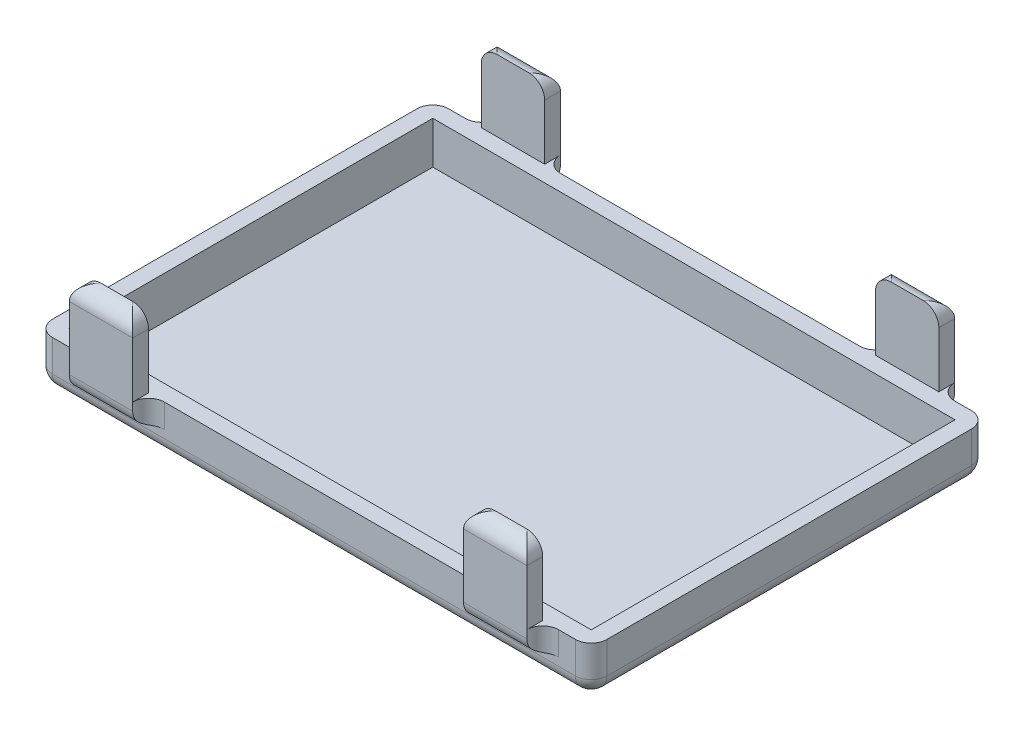
from build123d import *

# Parameters (mm, degrees)
SKETCH1_W            = 350
SKETCH1_H            = 250
SKETCH1_W_2          = 329.63
SKETCH1_H_2          = 229.64
BOSS_EXTRUDE2_DEPTH  = 30
SKETCH1_3_W          = 329.63
SKETCH1_3_H          = 229.64
BOSS_EXTRUDE3_DEPTH  = 3.3
FILLET1_R            = 10
SKETCH3_W            = 40
SKETCH3_H            = 60
BOSS_EXTRUDE4_DEPTH  = 10
FILLET3_R            = 10
FILLET4_R            = 10
FILLET3_OF_MIRROR3_R = 10
FILLET4_OF_MIRROR3_R = 10
FILLET5_START        = 25.0000001
FILLET5_DEPTH        = 4.9999999
FILLET5_START_2      = 14.9999999
FILLET5_2_DEPTH      = 10.0000002
FILLET5_START_3      = -155
FILLET5_3_DEPTH      = 310


with BuildPart() as part:
    # Sketch1 → Boss-Extrude2 (new body)
    with BuildSketch(Plane(origin=(0, 0, 0), x_dir=(1, 0, 0), z_dir=(0, 1, 0))):
        Rectangle(SKETCH1_W, SKETCH1_H)
        Rectangle(SKETCH1_W_2, SKETCH1_H_2, mode=Mode.SUBTRACT)
    extrude(amount=BOSS_EXTRUDE2_DEPTH)

    # Sketch1<3> → Boss-Extrude3 (add)
    with BuildSketch(Plane(origin=(0, 0, 0), x_dir=(1, 0, 0), z_dir=(0, 1, 0))):
        Rectangle(SKETCH1_3_W, SKETCH1_3_H)
    extrude(amount=BOSS_EXTRUDE3_DEPTH)

    # Fillet1
    fillet1_edges = [part.edges().sort_by_distance(p)[0] for p in [
        (0, 0, -125),
        (175, 0, 0),
        (0, 0, 125),
        (-175, 0, 0),
        (-175, 15, -125),
        (175, 15, -125),
        (175, 15, 125),
        (-175, 15, 125),
    ]]
    fillet(fillet1_edges, radius=FILLET1_R)

    # Sketch3 → Boss-Extrude4 (add)
    with BuildSketch(Plane.XY.offset(125)):
        with Locations((-124.4, 45)):
            Rectangle(SKETCH3_W, SKETCH3_H)
    boss_extrude4 = extrude(amount=BOSS_EXTRUDE4_DEPTH)

    # Fillet3
    fillet3_edges = [part.edges().sort_by_distance(p)[0] for p in [
        (-124.4, 15, 135),
    ]]
    fillet(fillet3_edges, radius=FILLET3_R - 0.0001)  # a hair under: the kernel refuses the full size

    # Fillet4
    fillet4_edges = [part.edges().sort_by_distance(p)[0] for p in [
        (-124.4, 75, 135),
        (-104.4, 75, 130),
        (-144.4, 75, 130),
    ]]
    fillet(fillet4_edges, radius=FILLET4_R - 0.0001)  # a hair under: the kernel refuses the full size

    # Mirror3: Boss-Extrude4 across plane
    add(boss_extrude4.mirror(Plane.XY))

    # Fillet3 of Mirror3
    fillet3_of_mirror3_edges = [part.edges().sort_by_distance(p)[0] for p in [
        (-124.4, 15, -135),
    ]]
    fillet(fillet3_of_mirror3_edges, radius=FILLET3_OF_MIRROR3_R - 0.0001)  # a hair under: the kernel refuses the full size

    # Fillet4 of Mirror3
    fillet4_of_mirror3_edges = [part.edges().sort_by_distance(p)[0] for p in [
        (-124.4, 75, -135),
        (-104.4, 75, -130),
        (-144.4, 75, -130),
    ]]
    fillet(fillet4_of_mirror3_edges, radius=FILLET4_OF_MIRROR3_R - 0.0001)  # a hair under: the kernel refuses the full size

    # Mirror4: read off the stored shape, not the designer's step
    # Mirror4: part across plane


with BuildPart() as part_1:
    add(part.part)
    add(part.part.mirror(Plane(origin=(0, 0, 0), x_dir=(0, 0, 1), z_dir=(1, 0, 0))))

    # Fillet5: read off the stored shape, not the designer's step
    # Fillet5 outline → Fillet5 (add)
    with BuildSketch(Plane(origin=(0, 0, 0), x_dir=(1, 0, 0), z_dir=(0, 1, 0)).offset(FILLET5_START)):
        with BuildLine():
            Line((104.4, 125), (104.4, 135))
            ThreePointArc((104.4, 135), (101.471067812, 127.928932188), (94.4, 125))
            Line((94.4, 125), (104.4, 125))
        make_face()
        with BuildLine():
            Line((144.4, 135), (144.4, 125))
            Line((144.4, 125), (154.4, 125))
            ThreePointArc((154.4, 125), (147.328932188, 127.928932188), (144.4, 135))
        make_face()
        with BuildLine():
            Line((-154.4, 125), (-144.4, 125))
            Line((-144.4, 125), (-144.4, 135))
            ThreePointArc((-144.4, 135), (-147.328932188, 127.928932188), (-154.4, 125))
        make_face()
        with BuildLine():
            Line((-104.4, 125), (-94.4, 125))
            ThreePointArc((-94.4, 125), (-101.471067812, 127.928932188), (-104.4, 135))
            Line((-104.4, 135), (-104.4, 125))
        make_face()
        with BuildLine():
            Line((-144.4, -135), (-144.4, -125))
            Line((-144.4, -125), (-154.4, -125))
            ThreePointArc((-154.4, -125), (-147.328932188, -127.928932188), (-144.4, -135))
        make_face()
        with BuildLine():
            ThreePointArc((-104.4, -135), (-101.471067812, -127.928932188), (-94.4, -125))
            Line((-94.4, -125), (-104.4, -125))
            Line((-104.4, -125), (-104.4, -135))
        make_face()
        with BuildLine():
            Line((154.4, -125), (144.4, -125))
            Line((144.4, -125), (144.4, -135))
            ThreePointArc((144.4, -135), (147.328932188, -127.928932188), (154.4, -125))
        make_face()
        with BuildLine():
            ThreePointArc((94.4, -125), (101.471067812, -127.928932188), (104.4, -135))
            Line((104.4, -135), (104.4, -125))
            Line((104.4, -125), (94.4, -125))
        make_face()
    extrude(amount=FILLET5_DEPTH)

    # Fillet5 2 outline → Fillet5 2 (add)
    with BuildSketch(Plane(origin=(0, 0, 0), x_dir=(1, 0, 0), z_dir=(0, 1, 0)).offset(FILLET5_START_2)):
        with BuildLine():
            Line((104.4, 125), (104.4, 135))
            ThreePointArc((104.4, 135), (101.471067812, 127.928932188), (94.4, 125))
            Line((94.4, 125), (104.4, 125))
        make_face()
        with BuildLine():
            Line((144.4, 135), (144.4, 125))
            Line((144.4, 125), (154.4, 125))
            ThreePointArc((154.4, 125), (147.328932188, 127.928932188), (144.4, 135))
        make_face()
        with BuildLine():
            Line((-154.4, 125), (-144.4, 125))
            Line((-144.4, 125), (-144.4, 135))
            ThreePointArc((-144.4, 135), (-147.328932188, 127.928932188), (-154.4, 125))
        make_face()
        with BuildLine():
            Line((-104.4, 125), (-94.4, 125))
            ThreePointArc((-94.4, 125), (-101.471067812, 127.928932188), (-104.4, 135))
            Line((-104.4, 135), (-104.4, 125))
        make_face()
        with BuildLine():
            Line((-144.4, -135), (-144.4, -125))
            Line((-144.4, -125), (-154.4, -125))
            ThreePointArc((-154.4, -125), (-147.328932188, -127.928932188), (-144.4, -135))
        make_face()
        with BuildLine():
            ThreePointArc((-104.4, -135), (-101.471067812, -127.928932188), (-94.4, -125))
            Line((-94.4, -125), (-104.4, -125))
            Line((-104.4, -125), (-104.4, -135))
        make_face()
        with BuildLine():
            Line((154.4, -125), (144.4, -125))
            Line((144.4, -125), (144.4, -135))
            ThreePointArc((144.4, -135), (147.328932188, -127.928932188), (154.4, -125))
        make_face()
        with BuildLine():
            ThreePointArc((94.4, -125), (101.471067812, -127.928932188), (104.4, -135))
            Line((104.4, -135), (104.4, -125))
            Line((104.4, -125), (94.4, -125))
        make_face()
    extrude(amount=FILLET5_2_DEPTH)

    # Fillet5 3 outline → Fillet5 3 (cut)
    with BuildSketch(Plane.YZ.offset(FILLET5_START_3)):
        with BuildLine():
            Line((25, 135), (14.9999999, 135))
            Line((14.9999999, 135), (15, 125))
            ThreePointArc((15, 125), (17.928932188, 132.071067812), (25, 135))
        make_face()
        with BuildLine():
            ThreePointArc((25, -135), (17.928932188, -132.071067812), (15, -125))
            Line((15, -125), (14.9999999, -135))
            Line((14.9999999, -135), (25, -135))
        make_face()
    extrude(amount=FILLET5_3_DEPTH, mode=Mode.SUBTRACT)


solid = part_1.part
